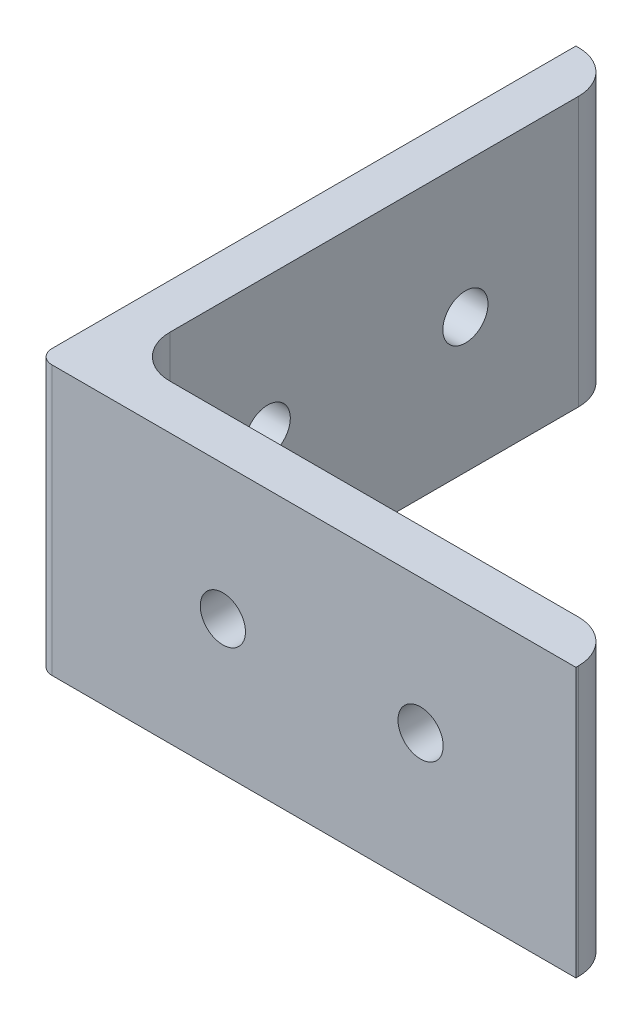
from build123d import *

# Parameters (mm, degrees)
BOSS_EXTRUDE1_DEPTH = 19.05
FILLET1_R           = 3
FILLET2_R           = 1
SKETCH2_R           = 1.6
CUT_EXTRUDE1_DEPTH  = 58.15
SKETCH3_R           = 1.6
CUT_EXTRUDE2_DEPTH  = 58.15


with BuildPart() as part:
    # Sketch1 → Boss-Extrude1 (new body)
    with BuildSketch(Plane(origin=(0, 0, 0), x_dir=(1, 0, 0), z_dir=(0, 1, 0))):
        Polygon((0, 0), (0, 38.1), (3.175, 38.1), (3.175, 3.175), (38.1, 3.175), (38.1, 0), align=None)
    extrude(amount=BOSS_EXTRUDE1_DEPTH)

    # Fillet1
    fillet1_edges = [part.edges().sort_by_distance(p)[0] for p in [
        (38.1, 9.525, -3.175),
        (3.175, 9.525, -3.175),
        (3.175, 9.525, -38.1),
    ]]
    fillet(fillet1_edges, radius=FILLET1_R)

    # Fillet2
    fillet2_edges = [part.edges().sort_by_distance(p)[0] for p in [
        (0, 9.525, 0),
    ]]
    fillet(fillet2_edges, radius=FILLET2_R)

    # Sketch2 → Cut-Extrude1 (cut, through all)
    with BuildSketch(Plane.XY):
        with Locations((13.1, 9.525)):
            Circle(SKETCH2_R)
        with Locations((27.1, 9.525)):
            Circle(SKETCH2_R)
    extrude(amount=-CUT_EXTRUDE1_DEPTH, mode=Mode.SUBTRACT)

    # Sketch3 → Cut-Extrude2 (cut, through all)
    with BuildSketch(Plane.ZY):
        with Locations((-27.1, 9.525)):
            Circle(SKETCH3_R)
        with Locations((-13.1, 9.525)):
            Circle(SKETCH3_R)
    extrude(amount=-CUT_EXTRUDE2_DEPTH, mode=Mode.SUBTRACT)


solid = part.part
